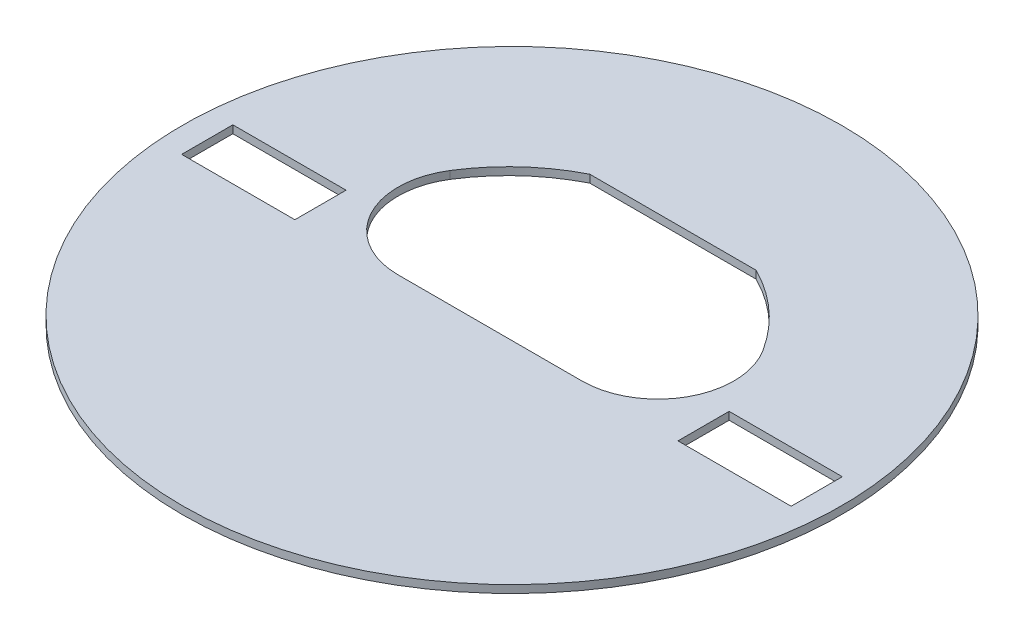
from build123d import *

# Parameters (mm, degrees)
CUT_EXTRUDE1_DEPTH           = 5
CUT_EXTRUDE3_DEPTH           = 60
SKETCH8_R                    = 43
CUT_EXTRUDE4_DEPTH           = 53
FILLET1_R                    = 7
SKETCH12_W                   = 6.5
SKETCH12_H                   = 51.5
CUT_REVOLVE1_ANGLE           = 60
CUT_REVOLVE1_OTHER_WAY_ANGLE = 60
SKETCH18_W                   = 13
SKETCH18_H                   = 8
CUT_EXTRUDE13_DEPTH          = 5
SKETCH20_W                   = 100
SKETCH20_H                   = 7
CUT_EXTRUDE15_DEPTH          = 5
SKETCH19_R                   = 1.5
CUT_EXTRUDE14_DEPTH          = 12
FILLET3_R                    = 4
SKETCH24_W                   = 2
SKETCH24_H                   = 3
BOSS_EXTRUDE3_DEPTH          = 2
CIRPATTERN2_COUNT            = 5
SKETCH26_W                   = 5
SKETCH26_H                   = 51.5
CUT_REVOLVE2_ANGLE           = 50
CUT_REVOLVE2_OTHER_WAY_ANGLE = 50
SKETCH29_W                   = 16.2
SKETCH29_H                   = 11.2
SKETCH29_W_2                 = 13
SKETCH29_H_2                 = 8
BOSS_EXTRUDE4_DEPTH          = 19
SKETCH36_W                   = 2
SKETCH36_H                   = 2
BOSS_EXTRUDE7_DEPTH          = 5
SKETCH37_W                   = 2
SKETCH37_H                   = 2
BOSS_EXTRUDE8_DEPTH          = 12.5
SKETCH40_W                   = 2
SKETCH40_H                   = 2
BOSS_EXTRUDE9_DEPTH          = 5
FILLET8_R                    = 9
SKETCH50_W                   = 13
SKETCH50_H                   = 5
CUT_EXTRUDE23_DEPTH          = 7
SKETCH51_R                   = 42.5
SKETCH51_W                   = 14.6
SKETCH51_H                   = 6.6
BOSS_EXTRUDE10_DEPTH         = 1
INTERSECT2_START             = 17.5
INTERSECT2_OUTLINE_R         = 45
INTERSECT2_OUTLINE_W         = 13
INTERSECT2_OUTLINE_H         = 8
INTERSECT2_DEPTH             = 59
INTERSECT2_2_OUTLINE_R       = 45
INTERSECT2_2_OUTLINE_W       = 13
INTERSECT2_2_OUTLINE_H       = 5
INTERSECT2_2_DEPTH           = 16
INTERSECT2_START_2           = 16
INTERSECT2_3_OUTLINE_R       = 45
INTERSECT2_3_OUTLINE_R_2     = 43
INTERSECT2_3_DEPTH           = 1.5
INTERSECT3_START             = -40.6
INTERSECT3_OUTLINE_W         = 14.5
INTERSECT3_OUTLINE_H         = 2
INTERSECT3_DEPTH             = 5


# Read off the part's stored shape, not the designer's step: Intersect2, Intersect3
with BuildPart() as part:
    # Sketch1 → Revolve1 (revolve)
    with BuildSketch(Plane.XY, mode=Mode.PRIVATE) as revolve1_sk:
        with BuildLine():
            Line((0, 76.5), (0, 11.5))
            Line((0, 11.5), (22.5, 11.5))
            Line((22.5, 11.5), (22.5, 0))
            Line((22.5, 0), (25, 0))
            Line((25, 0), (25, 11.5))
            Line((25, 11.5), (45, 11.5))
            Line((45, 11.5), (45, 71.5))
            ThreePointArc((45, 71.5), (43.535533906, 75.035533906), (40, 76.5))
            Line((40, 76.5), (0, 76.5))
        make_face()
    revolve(revolve1_sk.sketch.rotate(Axis((0, 2, 0), (0, 1, 0)), 90), axis=Axis((0, 2, 0), (0, 1, 0)))

    # Sketch5 → Cut-Extrude1 (cut)
    with BuildSketch(Plane(origin=(0, 76.5, 0), x_dir=(1, 0, 0), z_dir=(0, 1, 0))):
        with BuildLine():
            Line((-45, 0), (45, 0))
            ThreePointArc((45, 0), (0, 45), (-45, 0))
        make_face()
    extrude(amount=-CUT_EXTRUDE1_DEPTH, mode=Mode.SUBTRACT)

    # Sketch7 → Cut-Extrude3 (cut)
    with BuildSketch(Plane.XZ.offset(-11.5)):
        with BuildLine():
            Line((21, 0), (-21, 0))
            ThreePointArc((-21, 0), (-18.277714988, -10.340461055), (-10.816653826, -18))
            Line((-10.816653826, -18), (10.816653826, -18))
            ThreePointArc((10.816653826, -18), (18.277714988, -10.340461055), (21, 0))
        make_face()
    extrude(amount=-CUT_EXTRUDE3_DEPTH, mode=Mode.SUBTRACT)

    # Sketch8 → Cut-Extrude4 (cut)
    with BuildSketch(Plane(origin=(0, 69, 0), x_dir=(1, 0, 0), z_dir=(0, 1, 0))):
        with Locations(Location((0, 0, 0), (0, 0, 270))):
            Circle(SKETCH8_R)
        with BuildLine():
            Line((22.912878475, -2), (-22.981606036, -2))
            ThreePointArc((-22.981606036, -2), (-20.067855169, 10.855581536), (-10.573881727, 20))
            Line((-10.573881727, 20), (10.505154166, 20))
            ThreePointArc((10.505154166, 20), (19.999127608, 10.855581536), (22.912878475, -2))
        make_face(mode=Mode.SUBTRACT)
    extrude(amount=-CUT_EXTRUDE4_DEPTH, mode=Mode.SUBTRACT)

    # Fillet1
    fillet1_edges = [part.edges().sort_by_distance(p)[0] for p in [
        (-21, 41.5, 0),
        (21, 41.5, 0),
    ]]
    fillet(fillet1_edges, radius=FILLET1_R)

    # Sketch12 → Cut-Revolve1 (revolve, cut)
    with BuildSketch(Plane(origin=(0, 0, 0), x_dir=(0, 0, -1), z_dir=(1, 0, 0))):
        with Locations((-44.75, 43.25)):
            Rectangle(SKETCH12_W, SKETCH12_H)
    revolve(axis=Axis((0, 71.5, 0), (0, -1, 0)), revolution_arc=CUT_REVOLVE1_ANGLE, mode=Mode.SUBTRACT)

    # Sketch12 → Cut-Revolve1 other way (revolve, cut)
    with BuildSketch(Plane(origin=(0, 0, 0), x_dir=(0, 0, -1), z_dir=(1, 0, 0))):
        with Locations((-44.75, 43.25)):
            Rectangle(SKETCH12_W, SKETCH12_H)
    revolve(axis=Axis((0, 71.5, 0), (0, 1, 0)), revolution_arc=CUT_REVOLVE1_OTHER_WAY_ANGLE, mode=Mode.SUBTRACT)

    # Sketch18 → Cut-Extrude13 (cut)
    with BuildSketch(Plane(origin=(0, 71.5, 0), x_dir=(1, 0, 0), z_dir=(0, 1, 0))):
        with Locations((0, 30)):
            Rectangle(SKETCH18_W, SKETCH18_H)
    extrude(amount=-CUT_EXTRUDE13_DEPTH, mode=Mode.SUBTRACT)

    # Sketch20 → Cut-Extrude15 (cut)
    with BuildSketch(Plane(origin=(0, 76.5, 0), x_dir=(1, 0, 0), z_dir=(0, 1, 0))):
        with Locations((0, -3.5)):
            Rectangle(SKETCH20_W, SKETCH20_H)
    extrude(amount=-CUT_EXTRUDE15_DEPTH, mode=Mode.SUBTRACT)

    # Sketch19 → Cut-Extrude14 (cut)
    with BuildSketch(Plane(origin=(0, 0, 7), x_dir=(-1, 0, 0), z_dir=(0, 0, -1))):
        with Locations((0, 74)):
            Circle(SKETCH19_R)
        with Locations((-30, 74)):
            Circle(SKETCH19_R)
        with Locations((29.452221542, 74)):
            Circle(SKETCH19_R)
    extrude(amount=-CUT_EXTRUDE14_DEPTH, mode=Mode.SUBTRACT)

    # Fillet3
    fillet3_edges = [part.edges().sort_by_distance(p)[0] for p in [
        (0, 11.5, 45),
    ]]
    fillet(fillet3_edges, radius=FILLET3_R)

    # Sketch24 → Boss-Extrude3 (add)
    with BuildSketch(Plane.XZ):
        with Locations((0, -22.5)):
            Rectangle(SKETCH24_W, SKETCH24_H)
    boss_extrude3 = extrude(amount=-BOSS_EXTRUDE3_DEPTH)

    # CirPattern2: Boss-Extrude3 ×5 about axis
    cirpattern2_axis = Axis((0, 0, 0), (0, 1, 0))
    for i in range(1, CIRPATTERN2_COUNT):
        add(boss_extrude3.rotate(cirpattern2_axis, i * 360 / CIRPATTERN2_COUNT))

    # Sketch26 → Cut-Revolve2 (revolve, cut)
    with BuildSketch(Plane(origin=(0, 0, 0), x_dir=(0, 0, -1), z_dir=(1, 0, 0))):
        with Locations((45.056943441, 43.25)):
            Rectangle(SKETCH26_W, SKETCH26_H)
    revolve(axis=Axis((0, 2, 0), (0, -1, 0)), revolution_arc=CUT_REVOLVE2_ANGLE, mode=Mode.SUBTRACT)

    # Sketch26 → Cut-Revolve2 other way (revolve, cut)
    with BuildSketch(Plane(origin=(0, 0, 0), x_dir=(0, 0, -1), z_dir=(1, 0, 0))):
        with Locations((45.056943441, 43.25)):
            Rectangle(SKETCH26_W, SKETCH26_H)
    revolve(axis=Axis((0, 2, 0), (0, 1, 0)), revolution_arc=CUT_REVOLVE2_OTHER_WAY_ANGLE, mode=Mode.SUBTRACT)

    # Sketch29 → Boss-Extrude4 (add)
    with BuildSketch(Plane.XZ.offset(-69)):
        with Locations((0, -30)):
            Rectangle(SKETCH29_W, SKETCH29_H)
        with Locations((0, -30)):
            Rectangle(SKETCH29_W_2, SKETCH29_H_2, mode=Mode.SUBTRACT)
    extrude(amount=BOSS_EXTRUDE4_DEPTH)

    # Fillet8
    fillet8_edges = [part.edges().sort_by_distance(p)[0] for p in [
        (-22.981606036, 42.5, 2),
        (22.912878475, 42.5, 2),
    ]]
    fillet(fillet8_edges, radius=FILLET8_R)

    # Sketch50 → Cut-Extrude23 (cut)
    with BuildSketch(Plane(origin=(0, 16, 0), x_dir=(1, 0, 0), z_dir=(0, 1, 0))):
        with Locations((32, 0)):
            Rectangle(SKETCH50_W, SKETCH50_H)
        with Locations((-32, 0)):
            Rectangle(SKETCH50_W, SKETCH50_H)
    extrude(amount=-CUT_EXTRUDE23_DEPTH, mode=Mode.SUBTRACT)

    # Sketch51 → Boss-Extrude10 (add)
    with BuildSketch(Plane(origin=(0, 16, 0), x_dir=(1, 0, 0), z_dir=(0, 1, 0))):
        with Locations(Location((0, 0, 0), (0, 0, 270))):
            Circle(SKETCH51_R)
        with Locations((32, 0)):
            Rectangle(SKETCH51_W, SKETCH51_H, mode=Mode.SUBTRACT)
        with Locations((-32, 0)):
            Rectangle(SKETCH51_W, SKETCH51_H, mode=Mode.SUBTRACT)
        with BuildLine():
            ThreePointArc((-20.192156993, 12.210139591), (-20.468000439, 2.257604402), (-11.8918892, -2.8))
            Line((-11.8918892, -2.8), (11.823161639, -2.8))
            ThreePointArc((11.823161639, -2.8), (20.399272878, 2.257604402), (20.123429432, 12.210139591))
            ThreePointArc((20.123429432, 12.210139591), (15.996509538, 17.148165703), (10.697483593, 20.8))
            Line((10.697483593, 20.8), (-10.766211154, 20.8))
            ThreePointArc((-10.766211154, 20.8), (-16.065237099, 17.148165703), (-20.192156993, 12.210139591))
        make_face(mode=Mode.SUBTRACT)
    extrude(amount=BOSS_EXTRUDE10_DEPTH)

    # Intersect2 outline → Intersect2 (cut)
    with BuildSketch(Plane(origin=(0, 0, 0), x_dir=(1, 0, 0), z_dir=(0, 1, 0)).offset(INTERSECT2_START)):
        Circle(INTERSECT2_OUTLINE_R)
        with Locations((0, 30)):
            Rectangle(INTERSECT2_OUTLINE_W, INTERSECT2_OUTLINE_H, mode=Mode.SUBTRACT)
        with BuildLine():
            ThreePointArc((-18.186533479, 10.5), (-14.978608696, 14.718739128), (-10.816653826, 18))
            Line((-10.816653826, 18), (10.816653826, 18))
            ThreePointArc((10.816653826, 18), (14.978608696, 14.718739128), (18.186533479, 10.5))
            ThreePointArc((18.186533479, 10.5), (18.186533479, 3.5), (12.124355653, 0))
            Line((12.124355653, 0), (-12.124355653, 0))
            ThreePointArc((-12.124355653, 0), (-18.186533479, 3.5), (-18.186533479, 10.5))
        make_face(mode=Mode.SUBTRACT)
    extrude(amount=INTERSECT2_DEPTH, mode=Mode.SUBTRACT)

    # Intersect2 2 outline → Intersect2 2 (cut)
    with BuildSketch(Plane(origin=(0, 0, 0), x_dir=(1, 0, 0), z_dir=(0, 1, 0))):
        Circle(INTERSECT2_2_OUTLINE_R)
        with Locations((-32, 0)):
            Rectangle(INTERSECT2_2_OUTLINE_W, INTERSECT2_2_OUTLINE_H, mode=Mode.SUBTRACT)
        with Locations((32, 0)):
            Rectangle(INTERSECT2_2_OUTLINE_W, INTERSECT2_2_OUTLINE_H, mode=Mode.SUBTRACT)
        with BuildLine():
            ThreePointArc((-18.186533479, 10.5), (-14.978608696, 14.718739128), (-10.816653826, 18))
            Line((-10.816653826, 18), (10.816653826, 18))
            ThreePointArc((10.816653826, 18), (14.978608696, 14.718739128), (18.186533479, 10.5))
            ThreePointArc((18.186533479, 10.5), (18.186533479, 3.5), (12.124355653, 0))
            Line((12.124355653, 0), (-12.124355653, 0))
            ThreePointArc((-12.124355653, 0), (-18.186533479, 3.5), (-18.186533479, 10.5))
        make_face(mode=Mode.SUBTRACT)
    extrude(amount=INTERSECT2_2_DEPTH, mode=Mode.SUBTRACT)

    # Intersect2 3 outline → Intersect2 3 (cut)
    # profile 1 of 2: a face of its own
    with BuildSketch(Plane(origin=(0, 0, 0), x_dir=(1, 0, 0), z_dir=(0, 1, 0)).offset(INTERSECT2_START_2)):
        Circle(INTERSECT2_3_OUTLINE_R)
        Circle(INTERSECT2_3_OUTLINE_R_2, mode=Mode.SUBTRACT)
    # profile 2 of 2: a face of its own
    with BuildSketch(Plane(origin=(0, 0, 0), x_dir=(1, 0, 0), z_dir=(0, 1, 0)).offset(INTERSECT2_START_2)):
        with BuildLine():
            Line((-11.8918892, -2), (11.823161639, -2))
            ThreePointArc((11.823161639, -2), (19.699182165, 2.644738737), (19.445856551, 11.784822073))
            ThreePointArc((19.445856551, 11.784822073), (15.52739893, 16.493045158), (10.505154166, 20))
            Line((10.505154166, 20), (-10.573881727, 20))
            ThreePointArc((-10.573881727, 20), (-15.596126491, 16.493045158), (-19.514584112, 11.784822073))
            ThreePointArc((-19.514584112, 11.784822073), (-19.767909726, 2.644738737), (-11.8918892, -2))
        make_face()
        with BuildLine():
            Line((-10.816653826, 18), (10.816653826, 18))
            ThreePointArc((10.816653826, 18), (14.978608696, 14.718739128), (18.186533479, 10.5))
            ThreePointArc((18.186533479, 10.5), (18.186533479, 3.5), (12.124355653, 0))
            Line((12.124355653, 0), (-12.124355653, 0))
            ThreePointArc((-12.124355653, 0), (-18.186533479, 3.5), (-18.186533479, 10.5))
            ThreePointArc((-18.186533479, 10.5), (-14.978608696, 14.718739128), (-10.816653826, 18))
        make_face(mode=Mode.SUBTRACT)
    extrude(amount=INTERSECT2_3_DEPTH, mode=Mode.SUBTRACT)


with BuildPart() as body_2:
    # Sketch36 → Boss-Extrude7 (new body)
    with BuildSketch(Plane(origin=(0, 0, -35.6), x_dir=(-1, 0, 0), z_dir=(0, 0, -1))):
        with Locations((-6.159647943, 37.918102195)):
            Rectangle(SKETCH36_W, SKETCH36_H)
    extrude(amount=BOSS_EXTRUDE7_DEPTH)

    # Sketch37 → Boss-Extrude8 (add)
    with BuildSketch(Plane.ZY.offset(-5.159647943)):
        with Locations((-39.597351245, 37.918102195)):
            Rectangle(SKETCH37_W, SKETCH37_H)
    extrude(amount=BOSS_EXTRUDE8_DEPTH)

    # Sketch40 → Boss-Extrude9 (add)
    with BuildSketch(Plane(origin=(0, 0, -35.6), x_dir=(-1, 0, 0), z_dir=(0, 0, -1))):
        with Locations((6.340352057, 37.918102195)):
            Rectangle(SKETCH40_W, SKETCH40_H)
    extrude(amount=BOSS_EXTRUDE9_DEPTH)

    # Intersect3 outline → Intersect3 (cut)
    with BuildSketch(Plane.XY.offset(INTERSECT3_START)):
        with Locations((-0.090352057, 37.918102195)):
            Rectangle(INTERSECT3_OUTLINE_W, INTERSECT3_OUTLINE_H)
    extrude(amount=INTERSECT3_DEPTH, mode=Mode.SUBTRACT)


solid = part.part
